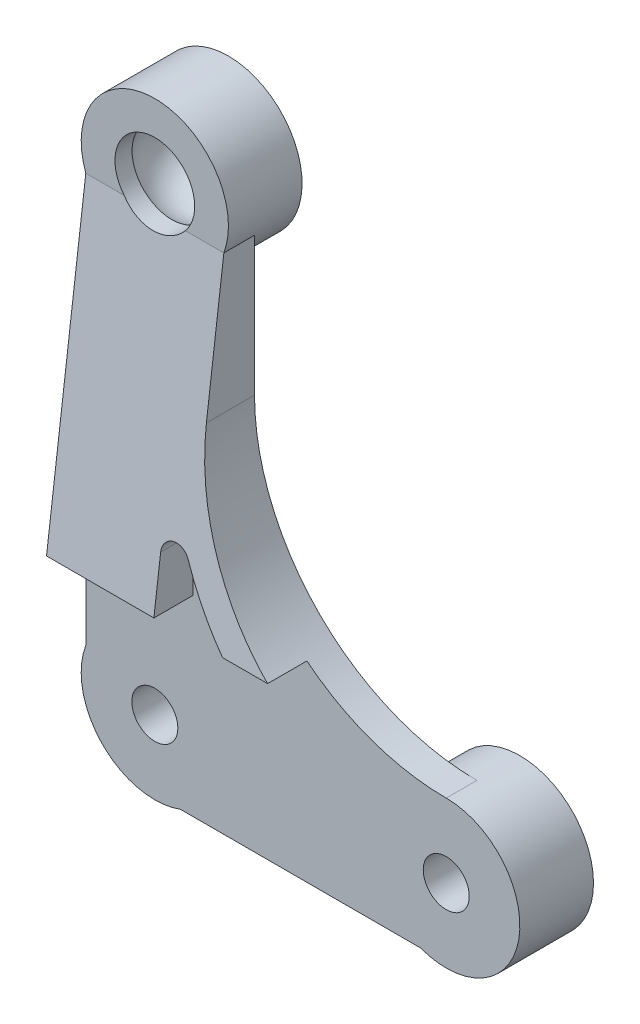
from build123d import *
from build123d.topology import SkipClean

# Parameters (mm, degrees)
SKETCH_1_R            = 1.5
SKETCH_1_R_2          = 2.6
EXTRUDE_1_DEPTH       = 2
EXTRUDE_START         = 2.8
SKETCH_7_R            = 1.5
SKETCH_7_R_2          = 2.6
EXTRUDE_4_DEPTH       = 2.8
EXTRUDE_START_2       = -4.5
EXTRUDE_5_DEPTH       = 7
EXTRUDE_START_3       = 2.5
EXTRUDE_5_2_DEPTH     = 7.413746647
EXTRUDE_START_4       = 2
EXTRUDE_5_3_OUTLINE_R = 1.5
EXTRUDE_5_3_DEPTH     = 4
CHAMFER_1_SIZE        = 0.5


with BuildPart() as part:
    # 草图1 → 凸台-拉伸1 (new body)
    with BuildSketch(Plane.XY):
        with BuildLine():
            Line((4.5, 19.3), (4.5, 28.329670691))
            ThreePointArc((4.5, 28.329670691), (0, 34.8), (-4.5, 28.329670691))
            Line((-4.5, 28.329670691), (-4.5, 1.670329309))
            ThreePointArc((-4.5, 1.670329309), (-3.39411255, -3.39411255), (1.670329309, -4.5))
            Line((1.670329309, -4.5), (17.329670691, -4.5))
            ThreePointArc((17.329670691, -4.5), (23.724404724, -0.848528137), (19, 4.8))
            ThreePointArc((19, 4.8), (8.746951673, 9.046951673), (4.5, 19.3))
        make_face()
        Circle(SKETCH_1_R, mode=Mode.SUBTRACT)
        with Locations((19, 0)):
            Circle(SKETCH_1_R, mode=Mode.SUBTRACT)
        with Locations((0, 30)):
            Circle(SKETCH_1_R_2, mode=Mode.SUBTRACT)
    extrude(amount=EXTRUDE_1_DEPTH)

    # 草图7 → 凸台-拉伸4 (add)
    with BuildSketch(Plane(origin=(0, 0, 0), x_dir=(-1, 0, 0), z_dir=(0, 0, -1)).offset(EXTRUDE_START)):
        with BuildLine():
            Line((-14.408703887, -1.4), (-4.591296113, -1.4))
            ThreePointArc((-4.591296113, -1.4), (3.39411255, -3.39411255), (1.4, 4.591296113))
            Line((1.4, 4.591296113), (1.4, 25.408703887))
            ThreePointArc((1.4, 25.408703887), (0, 34.8), (-1.4, 25.408703887))
            Line((-1.4, 25.408703887), (-1.4, 4.591296113))
            ThreePointArc((-1.4, 4.591296113), (-3.39411255, 3.39411255), (-4.591296113, 1.4))
            Line((-4.591296113, 1.4), (-14.426868498, 1.458241497))
            ThreePointArc((-14.426868498, 1.458241497), (-23.799903071, -0.030504201), (-14.408703887, -1.4))
        make_face()
        Circle(SKETCH_7_R, mode=Mode.SUBTRACT)
        with Locations((-19, 0)):
            Circle(SKETCH_7_R, mode=Mode.SUBTRACT)
        with Locations((0, 30)):
            Circle(SKETCH_7_R_2, mode=Mode.SUBTRACT)
    extrude(amount=-EXTRUDE_4_DEPTH)

    # 凸台-拉伸5: read off the stored shape, not the designer's step
    # 凸台-拉伸5 outline → 凸台-拉伸5 (add)
    with SkipClean():  # the faces are left unmerged after this step: merging them gives an invalid solid
        with BuildSketch(Plane.YZ.offset(EXTRUDE_START_2)):
            Polygon((8, 2), (28.329670691, 2), (8, 4.561025334), align=None)
        extrude(amount=EXTRUDE_5_DEPTH)
    add(part.part.scale(1), mode=Mode.REPLACE)  # the faces are merged on a copy

    # Extrude 5 2 outline → Extrude 5 2 (add)
    with SkipClean():  # the faces are left unmerged after this step: merging them gives an invalid solid
        with BuildSketch(Plane.YZ.offset(EXTRUDE_START_3)):
            Polygon((8, 2), (28.329670691, 2), (8, 4.561025334), align=None)
        extrude(amount=EXTRUDE_5_2_DEPTH)

    # Extrude 5 3 outline → Extrude 5 3 (cut)
    # profile 1 of 3: a face of its own
    with SkipClean():  # the faces are left unmerged after this step: merging them gives an invalid solid
        with BuildSketch(Plane.XY.offset(EXTRUDE_START_4)):
            with BuildLine():
                Line((2.5, 11.5), (2.5, 8))
                Line((2.5, 8), (-4.5, 8))
                Line((-4.5, 8), (-4.5, 1.670329309))
                ThreePointArc((-4.5, 1.670329309), (-3.39411255, -3.39411255), (1.670329309, -4.5))
                Line((1.670329309, -4.5), (17.329670691, -4.5))
                ThreePointArc((17.329670691, -4.5), (23.724404724, -0.848528137), (19, 4.8))
                ThreePointArc((19, 4.8), (14.183362168, 5.62337761), (9.913746647, 8))
                Line((9.913746647, 8), (6.976689308, 8))
                ThreePointArc((6.976689308, 8), (5.469210572, 9.857132985), (4.246086412, 11.912711334))
                ThreePointArc((4.246086412, 11.912711334), (3.209776536, 12.39709927), (2.5, 11.5))
            make_face()
            Circle(EXTRUDE_5_3_OUTLINE_R, mode=Mode.SUBTRACT)
            with Locations((19, 0)):
                Circle(EXTRUDE_5_3_OUTLINE_R, mode=Mode.SUBTRACT)
        # profile 2 of 3: a face of its own
        with BuildSketch(Plane.XY.offset(EXTRUDE_START_4)):
            with BuildLine():
                ThreePointArc((4.5, 19.3), (5.923290291, 13.035044837), (9.913746647, 8))
                Line((9.913746647, 8), (9.913746647, 28.329670691))
                Line((9.913746647, 28.329670691), (4.5, 28.329670691))
                Line((4.5, 28.329670691), (4.5, 19.3))
            make_face()
        # profile 3 of 3: a face of its own
        with BuildSketch(Plane.XY.offset(EXTRUDE_START_4)):
            with BuildLine():
                Line((1.992485884, 28.329670691), (-1.992485884, 28.329670691))
                ThreePointArc((-1.992485884, 28.329670691), (0, 27.4), (1.992485884, 28.329670691))
            make_face()
        extrude(amount=EXTRUDE_5_3_DEPTH, mode=Mode.SUBTRACT)

    # 草图11 → 切除-旋转1 (revolve, cut)
    with SkipClean():  # the faces are left unmerged after this step: merging them gives an invalid solid
        with BuildSketch(Plane(origin=(0, 0, 0), x_dir=(0, 0, -1), z_dir=(1, 0, 0)), mode=Mode.PRIVATE) as cut_revolve_1_sk:
            with BuildLine():
                Line((3.254540001, 30.511469826), (-2.454540001, 30.511469826))
                ThreePointArc((-2.454540001, 30.511469826), (0.4, 32.9), (3.254540001, 30.511469826))
            make_face()
        revolve(cut_revolve_1_sk.sketch.rotate(Axis((0, 30, -2.8), (0, 0, 1)), 90), axis=Axis((0, 30, -2.8), (0, 0, 1)), mode=Mode.SUBTRACT)

    # 倒角1
    chamfer_1_edges = [part.edges().sort_by_distance(p)[0] for p in [
        (2.6, 30, -2.8),
    ]]
    chamfer(chamfer_1_edges, length=CHAMFER_1_SIZE)


solid = part.part
